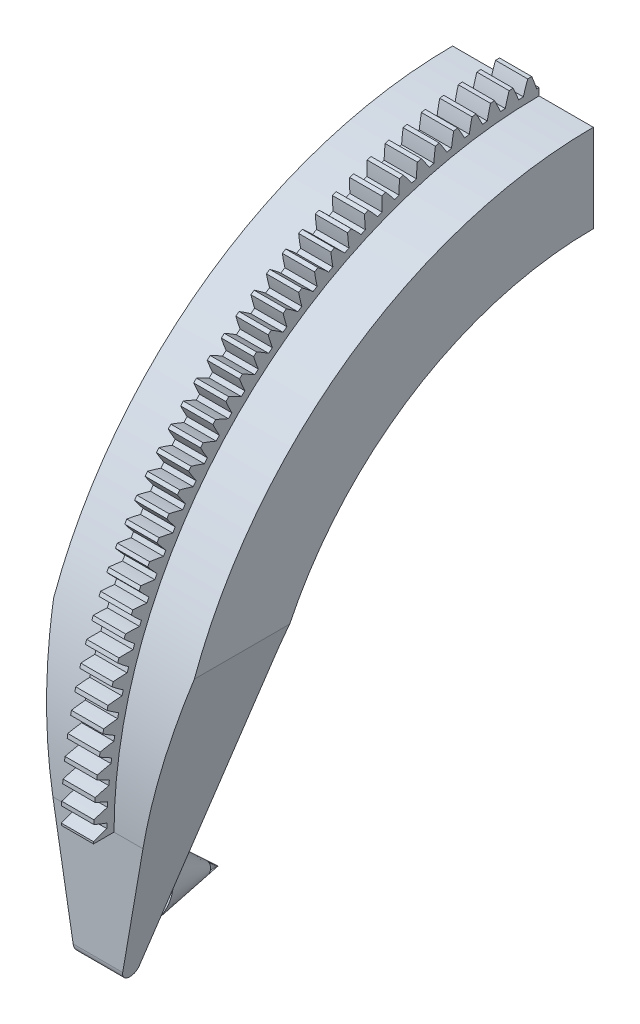
from build123d import *

# Parameters (mm, degrees)
BASPROSKE_W          = 5.5
BASPROSKE_H          = 76
TOOTHCUT_DEPTH       = 108.62086229
TEETHCUTS_COUNT      = 150
TEETHCUTS_ANGLE      = 357.6
BORSKE_R             = 4
BORE_DEPTH           = 50.0000508
CUT_EXTRUDE_1_DEPTH  = 108.613575976
EXTRUDE_1_DEPTH      = 12
EXTRUDE_1_DEPTH_BACK = 12
CUT_EXTRUDE_2_DEPTH  = 107.057740096


with BuildPart() as part:
    # BasProSke → Base-Revolve (revolve)
    with BuildSketch(Plane(origin=(0, 0, 0), x_dir=(1, 0, 0), z_dir=(0, 1, 0))):
        with Locations((2.75, 38)):
            Rectangle(BASPROSKE_W, BASPROSKE_H)
    revolve(axis=Axis((-10, 0, 0), (1, 0, 0)))

    # TooCutSke → ToothCut (cut, through all)
    with BuildSketch(Plane(origin=(0, 0, 0), x_dir=(0, 0, -1), z_dir=(1, 0, 0))):
        with BuildLine():
            ThreePointArc((0.406703699, 73.747878567), (0, 73.749), (-0.406703699, 73.747878567))
            ThreePointArc((-0.406703699, 73.747878567), (-0.811952715, 74.890043248), (-1.263002313, 76.014908211))
            ThreePointArc((-1.263002313, 76.014908211), (0, 76.0254), (1.263002313, 76.014908211))
            ThreePointArc((1.263002313, 76.014908211), (0.811952715, 74.890043248), (0.406703699, 73.747878567))
        make_face()
    toothcut = extrude(amount=TOOTHCUT_DEPTH, mode=Mode.SUBTRACT)

    # TeethCuts: ToothCut ×150 about axis
    teethcuts_axis = Axis((-10, 0, 0), (1, 0, 0))
    for i in range(1, TEETHCUTS_COUNT):
        add(toothcut.rotate(teethcuts_axis, i * TEETHCUTS_ANGLE / (TEETHCUTS_COUNT - 1)), mode=Mode.SUBTRACT)

    # BorSke → Bore (cut, symmetric)
    with BuildSketch(Plane(origin=(0, 0, 0), x_dir=(0, 0, -1), z_dir=(1, 0, 0))):
        Circle(BORSKE_R)
    extrude(amount=BORE_DEPTH, both=True, mode=Mode.SUBTRACT)

    # ｽｹｯﾁ1 → ｶｯﾄ - 押し出し1 (cut, through all)
    with BuildSketch(Plane(origin=(5.5, 0, 0), x_dir=(0, 0, -1), z_dir=(1, 0, 0))):
        with BuildLine():
            Line((0, 100), (0, 72.5))
            ThreePointArc((0, 72.5), (-51.265241636, 51.265241636), (-72.5, 0))
            Line((-72.5, 0), (-100, 0))
            ThreePointArc((-100, 0), (70.710678119, -70.710678119), (0, 100))
        make_face()
    extrude(amount=-CUT_EXTRUDE_1_DEPTH, mode=Mode.SUBTRACT)

    # ｽｹｯﾁ2 → ﾎﾞｽ - 押し出し1 (add, two sides: drawn at the far end of the back side and taken through both)
    with BuildSketch(Plane(origin=(2.75, 0, 0), x_dir=(0, 0, -1), z_dir=(1, 0, 0)).offset(-EXTRUDE_1_DEPTH_BACK)):
        with BuildLine():
            Line((0, 72.5), (0, 57.5))
            ThreePointArc((0, 57.5), (-32.505682733, 47.43027082), (-53.626202964, 20.748020523))
            Line((-53.626202964, 20.748020523), (-69.601055575, -20.541252709))
            ThreePointArc((-69.601055575, -20.541252709), (-71.27530289, -21.474519691), (-72.5, -20))
            Line((-72.5, -20), (-72.5, 0))
            ThreePointArc((-72.5, 0), (-51.265241636, 51.265241636), (0, 72.5))
        make_face()
    extrude(amount=EXTRUDE_1_DEPTH + EXTRUDE_1_DEPTH_BACK)

    # ｽｹｯﾁ3 → ｶｯﾄ - 押し出し2 (cut, through all)
    with BuildSketch(Plane.XY.offset(72.5)):
        Polygon((-9.25, 25), (-9.25, -30), (0.25, -30), align=None)
        Polygon((14.75, -30), (14.75, 25), (5.25, -30), align=None)
    extrude(amount=-CUT_EXTRUDE_2_DEPTH, mode=Mode.SUBTRACT)


with BuildPart() as body_2:
    # ｽｹｯﾁ4 → 回転1 (revolve)
    with BuildSketch(Plane(origin=(2.75, 0, 0), x_dir=(0, 0, -1), z_dir=(1, 0, 0))):
        Polygon((-65.992704179, -11.214956542), (-63.827693342, -5.619178841), (-52.003259928, -16.627483635), align=None)
    revolve(axis=Axis((2.75, -11.214956542, 65.992704179), (0, -0.3608351395345281, -0.9326296167702898)))


with BuildPart() as body_3:
    # ｽｹｯﾁ4<5> → 回転2 (revolve)
    with BuildSketch(Plane(origin=(2.75, 0, 0), x_dir=(0, 0, -1), z_dir=(1, 0, 0))):
        with BuildLine():
            ThreePointArc((-45.324189131, 35.383158136), (-47.6758241, 32.144452031), (-49.796460718, 28.75))
            Line((-49.796460718, 28.75), (-36.806079661, 21.25))
            Line((-36.806079661, 21.25), (-45.324189131, 35.383158136))
        make_face()
    revolve(axis=Axis((2.75, 28.75, 49.796460718), (0, -0.5000000000000039, -0.8660254037844364)))


solid = Compound([part.part, body_2.part, body_3.part])
